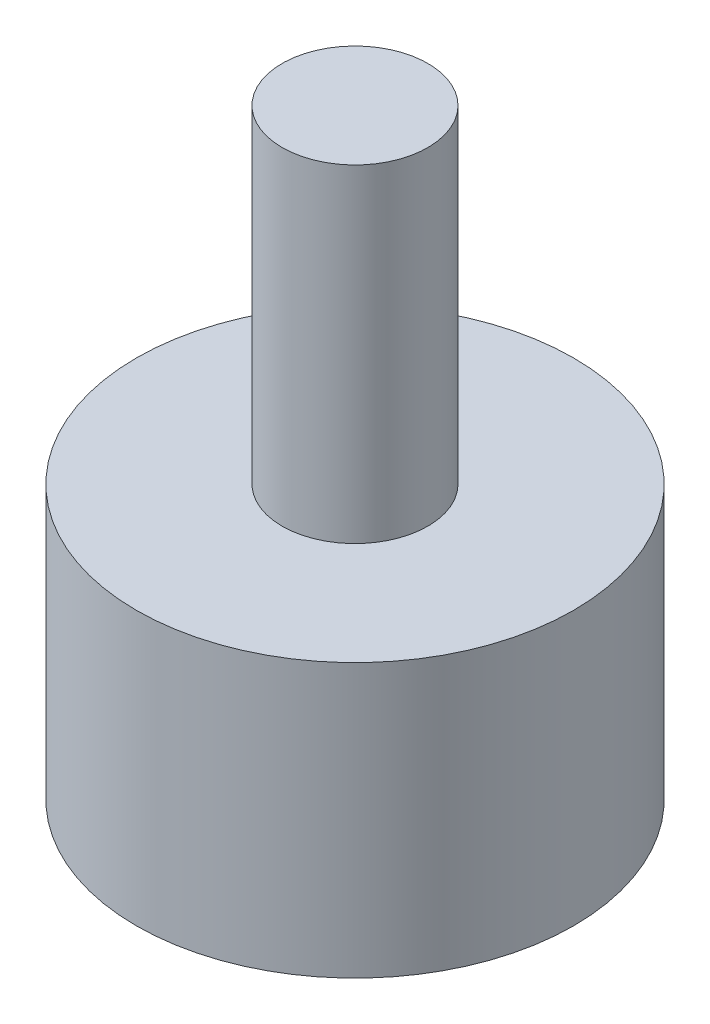
from build123d import *

# Parameters (mm, degrees)
SKETCH1_R           = 12
BOSS_EXTRUDE1_DEPTH = 15
SKETCH2_R           = 4
BOSS_EXTRUDE2_DEPTH = 18
SKETCH4_R           = 8
CUT_EXTRUDE1_DEPTH  = 2
DOME1_FACE_RADIUS   = 8
DOME1_HEIGHT        = 8
SKETCH5_R           = 10.75
SKETCH5_R_2         = 7.5
BOSS_EXTRUDE3_DEPTH = 1.5
CHAMFER1_SIZE       = 2
CHAMFER1_SIZE_2     = 3.464101615


with BuildPart() as part:
    # Sketch1 → Boss-Extrude1 (new body)
    with BuildSketch(Plane(origin=(0, 0, 0), x_dir=(1, 0, 0), z_dir=(0, 1, 0))):
        with Locations(Location((0, 0, 0), (0, 0, 270))):
            Circle(SKETCH1_R)
    extrude(amount=BOSS_EXTRUDE1_DEPTH)

    # Sketch2 → Boss-Extrude2 (add)
    with BuildSketch(Plane(origin=(0, 15, 0), x_dir=(1, 0, 0), z_dir=(0, 1, 0))):
        with Locations(Location((0, 0, 0), (0, 0, 270))):
            Circle(SKETCH2_R)
    extrude(amount=BOSS_EXTRUDE2_DEPTH)

    # Sketch4 → Cut-Extrude1 (cut)
    with BuildSketch(Plane.XZ):
        with Locations(Location((0, 0, 0), (0, 0, 270))):
            Circle(SKETCH4_R)
    extrude(amount=-CUT_EXTRUDE1_DEPTH, mode=Mode.SUBTRACT)

    # Dome1: a dome of height H over a round flat face of radius A is a cap of a sphere of radius (A * A + H * H) / (2 * H)
    dome1_r = (DOME1_FACE_RADIUS * DOME1_FACE_RADIUS + DOME1_HEIGHT * DOME1_HEIGHT) / (2 * DOME1_HEIGHT)
    dome1_base = Plane((0, 2, 0), z_dir=(0, -1, 0))
    with Locations(dome1_base.offset(DOME1_HEIGHT - dome1_r)):
        dome1_ball = Sphere(dome1_r, mode=Mode.PRIVATE)
    add(split(dome1_ball, bisect_by=dome1_base, keep=Keep.TOP, mode=Mode.PRIVATE))

    # Sketch5 → Boss-Extrude3 (add)
    with BuildSketch(Plane.XZ):
        with Locations(Location((0, 0, 0), (0, 0, 90))):
            Circle(SKETCH5_R)
        with Locations(Location((0, 0, 0), (0, 0, 90))):
            Circle(SKETCH5_R_2, mode=Mode.SUBTRACT)
    extrude(amount=BOSS_EXTRUDE3_DEPTH)

    # Chamfer1
    # the kernel refuses this chamfer: 3.464101615, 2 mm, written as the material it takes off along each edge
    with BuildSketch(Plane(origin=(0, -1.5, 0), x_dir=(0, 0, 1), z_dir=(1, 0, 0))) as chamfer1_piece_1_section:
        Polygon((10.75, -CHAMFER1_SIZE), (10.75 - CHAMFER1_SIZE_2, 0), (10.75, 0), align=None)
    chamfer1_piece_1 = revolve(axis=Axis((0, -1.5, 0), (0, -1, 0)), mode=Mode.PRIVATE)
    chamfer1_piece_1 = split(chamfer1_piece_1, bisect_by=Plane(origin=(0, 0, -8.554997787), z_dir=(0, -1, 0)), keep=Keep.TOP, mode=Mode.PRIVATE)
    add(chamfer1_piece_1, mode=Mode.SUBTRACT)


solid = part.part
